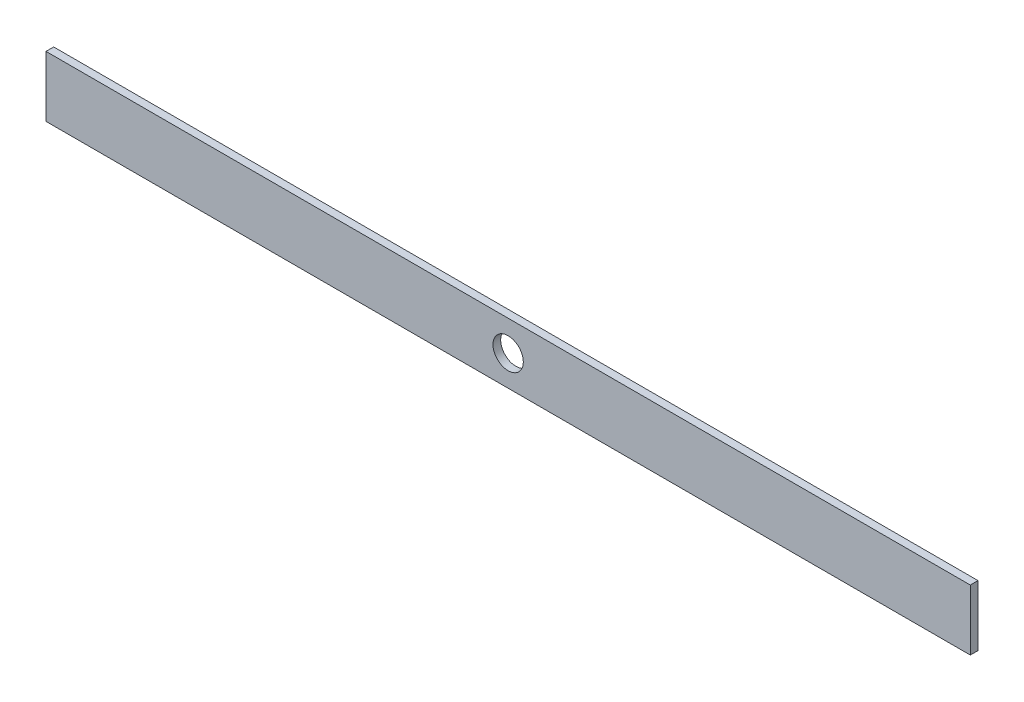
from build123d import *

# Parameters (mm, degrees)
SKETCH1_W           = 762
SKETCH1_H           = 50
BOSS_EXTRUDE1_DEPTH = 6.35
SKETCH2_R           = 12.5
CUT_EXTRUDE1_DEPTH  = 382.872128467


with BuildPart() as part:
    # Sketch1 → Boss-Extrude1 (new body)
    with BuildSketch(Plane.XY):
        Rectangle(SKETCH1_W, SKETCH1_H)
    extrude(amount=BOSS_EXTRUDE1_DEPTH)

    # Sketch2 → Cut-Extrude1 (cut, through all)
    with BuildSketch(Plane.XY.offset(6.35)):
        Circle(SKETCH2_R)
    extrude(amount=-CUT_EXTRUDE1_DEPTH, mode=Mode.SUBTRACT)


solid = part.part
